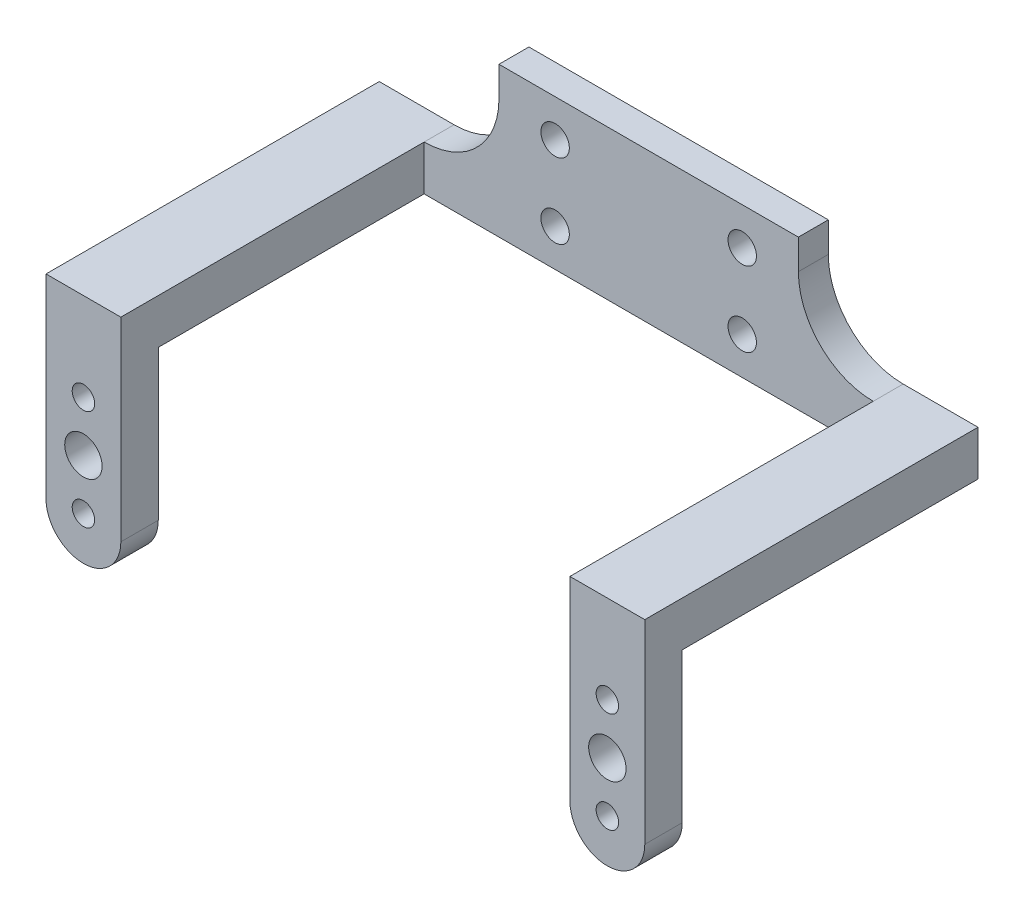
from build123d import *

# Parameters (mm, degrees)
SKETCH1_W           = 40
SKETCH1_H           = 20
SKETCH1_R           = 1.9
MAIN_MOUNTING_DEPTH = 4
SKETCH2_W           = 20
SKETCH2_H           = 20
EXTENTION_DEPTH     = 4
SKETCH3_W           = 10
SKETCH3_H           = 6
BOSS_EXTRUDE3_DEPTH = 40.52
SKETCH4_W           = 10
SKETCH4_H           = 5
BOSS_EXTRUDE4_DEPTH = 25
SKETCH5_R           = 1.5
SKETCH5_R_2         = 2.5
CUT_EXTRUDE1_DEPTH  = 62.537227757
SKETCH7_W           = 20
SKETCH7_H           = 14
CUT_EXTRUDE2_DEPTH  = 63.184165187
FILLET1_R           = 10
FILLET2_R           = 5


with BuildPart() as part:
    # Sketch1 → main mounting (new body)
    with BuildSketch(Plane.XY):
        with Locations((0, 10)):
            Rectangle(SKETCH1_W, SKETCH1_H)
        with Locations((-12.5, 15)):
            Circle(SKETCH1_R, mode=Mode.SUBTRACT)
        with Locations((-12.5, 5)):
            Circle(SKETCH1_R, mode=Mode.SUBTRACT)
        with Locations(Location((12.5, 5, 0), (0, 0, 180))):
            Circle(SKETCH1_R, mode=Mode.SUBTRACT)
        with Locations(Location((12.5, 15, 0), (0, 0, 180))):
            Circle(SKETCH1_R, mode=Mode.SUBTRACT)
    extrude(amount=MAIN_MOUNTING_DEPTH)

    # Sketch2 → extention (add)
    with BuildSketch(Plane(origin=(0, 0, 0), x_dir=(-1, 0, 0), z_dir=(0, 0, -1))):
        with Locations((30, 10)):
            Rectangle(SKETCH2_W, SKETCH2_H)
        with Locations((-30, 10)):
            Rectangle(SKETCH2_W, SKETCH2_H)
    extrude(amount=-EXTENTION_DEPTH)

    # Sketch3 → Boss-Extrude3 (add)
    with BuildSketch(Plane.XY.offset(4)):
        with Locations((-35, 3)):
            Rectangle(SKETCH3_W, SKETCH3_H)
        with Locations((35, 3)):
            Rectangle(SKETCH3_W, SKETCH3_H)
    extrude(amount=BOSS_EXTRUDE3_DEPTH)

    # Sketch4 → Boss-Extrude4 (add)
    with BuildSketch(Plane.XZ):
        with Locations((-35, 42.02)):
            Rectangle(SKETCH4_W, SKETCH4_H)
        with Locations((35, 42.02)):
            Rectangle(SKETCH4_W, SKETCH4_H)
    extrude(amount=BOSS_EXTRUDE4_DEPTH)

    # Sketch5 → Cut-Extrude1 (cut, through all)
    with BuildSketch(Plane(origin=(0, 0, 39.52), x_dir=(-1, 0, 0), z_dir=(0, 0, 1))):
        with Locations((35, 19.23)):
            Circle(SKETCH5_R)
        with Locations((35, 5.77)):
            Circle(SKETCH5_R)
        with Locations(Location((-35, 12.5, 0), (0, 0, 180))):
            Circle(SKETCH5_R_2)
        with Locations((35, 12.5)):
            Circle(SKETCH5_R_2)
        with Locations(Location((-35, 5.77, 0), (0, 0, 180))):
            Circle(SKETCH5_R)
        with Locations(Location((-35, 19.23, 0), (0, 0, 180))):
            Circle(SKETCH5_R)
    extrude(amount=CUT_EXTRUDE1_DEPTH, mode=Mode.SUBTRACT)

    # Sketch7 → Cut-Extrude2 (cut, through all)
    with BuildSketch(Plane.XY.offset(4)):
        with Locations((-30, 13)):
            Rectangle(SKETCH7_W, SKETCH7_H)
        with Locations((30, 13)):
            Rectangle(SKETCH7_W, SKETCH7_H)
    extrude(amount=-CUT_EXTRUDE2_DEPTH, mode=Mode.SUBTRACT)

    # Fillet1
    fillet1_edges = [part.edges().sort_by_distance(p)[0] for p in [
        (20, 6, 2),
        (-20, 6, 2),
    ]]
    fillet(fillet1_edges, radius=FILLET1_R)

    # Fillet2
    fillet2_edges = [part.edges().sort_by_distance(p)[0] for p in [
        (40, -25, 42.02),
        (30, -25, 42.02),
        (-40, -25, 42.02),
        (-30, -25, 42.02),
    ]]
    fillet(fillet2_edges, radius=FILLET2_R - 0.0001)  # a hair under: the kernel refuses the full size


solid = part.part
